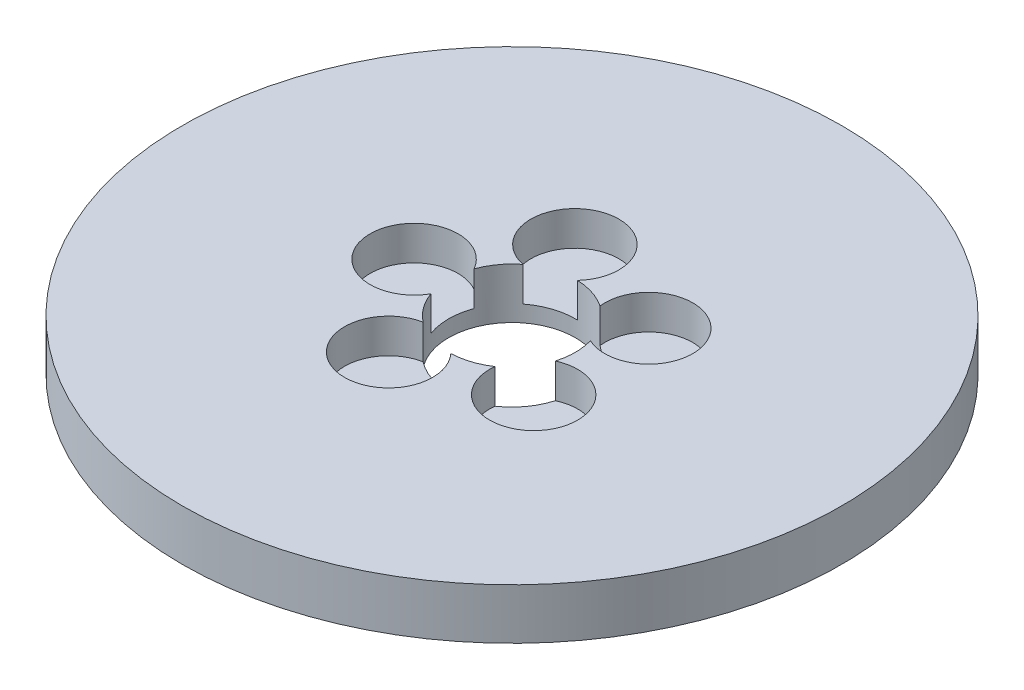
from build123d import *

# Parameters (mm, degrees)
SKETCH1_R           = 65
BOSS_EXTRUDE1_DEPTH = 10
SKETCH2_R           = 12.5
CUT_EXTRUDE1_DEPTH  = 93.466210045
SKETCH3_R           = 8.683348951
CUT_EXTRUDE2_DEPTH  = 6.774962278
CIRPATTERN1_COUNT   = 5


with BuildPart() as part:
    # Sketch1 → Boss-Extrude1 (new body)
    with BuildSketch(Plane(origin=(0, 0, 0), x_dir=(1, 0, 0), z_dir=(0, 1, 0))):
        Circle(SKETCH1_R)
    extrude(amount=BOSS_EXTRUDE1_DEPTH)

    # Sketch2 → Cut-Extrude1 (cut, through all)
    with BuildSketch(Plane(origin=(0, 0, 0), x_dir=(1, 0, 0), z_dir=(0, 1, 0))):
        Circle(SKETCH2_R)
    extrude(amount=CUT_EXTRUDE1_DEPTH, mode=Mode.SUBTRACT)

    # Sketch3 → Cut-Extrude2 (cut)
    with BuildSketch(Plane(origin=(0, 10, 0), x_dir=(1, 0, 0), z_dir=(0, 1, 0))):
        with Locations((-19.31200649, 0)):
            Circle(SKETCH3_R)
    cut_extrude2 = extrude(amount=-CUT_EXTRUDE2_DEPTH, mode=Mode.SUBTRACT)

    # CirPattern1: Cut-Extrude2 ×5 about axis
    cirpattern1_axis = Axis((0, 0, 0), (0, 1, 0))
    for i in range(1, CIRPATTERN1_COUNT):
        add(cut_extrude2.rotate(cirpattern1_axis, i * 360 / CIRPATTERN1_COUNT), mode=Mode.SUBTRACT)


solid = part.part
